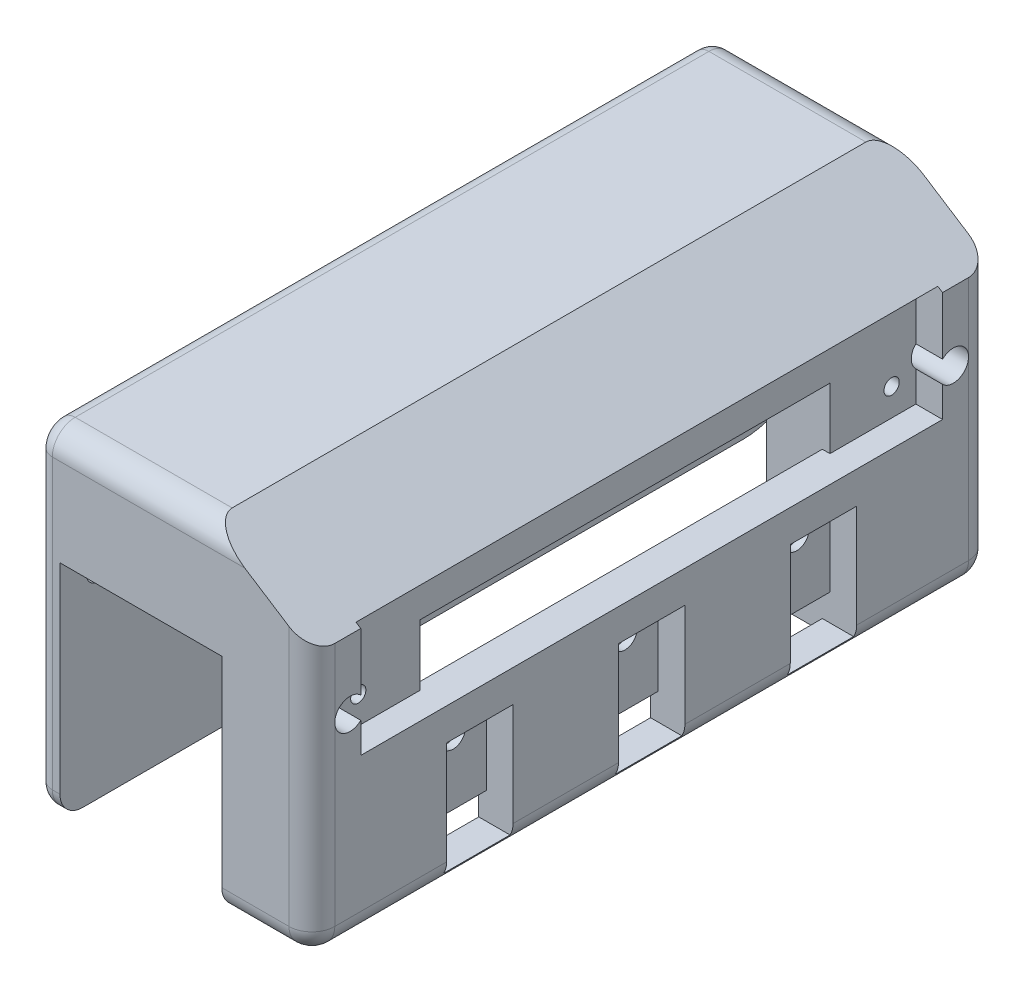
from build123d import *

# Parameters (mm, degrees)
RESSALTO_EXTRUS_O2_DEPTH      = 30
RESSALTO_EXTRUS_O3_START      = 3
RESSALTO_EXTRUS_O3_DEPTH      = 3
RESSALTO_EXTRUS_O4_DEPTH      = 3
RESSALTO_EXTRUS_O4_DEPTH_BACK = 8.8
ESBO_O10_R                    = 1.500000000000004
ESBO_O10_R_2                  = 1.5000000000000007
ESBO_O10_R_3                  = 1.5000000000000009
CORTE_EXTRUS_O3_DEPTH         = 9.999999999999998
CORTE_EXTRUS_O4_DEPTH         = 9.999999999999998
FILETE2_R                     = 2
ESBO_O13_R                    = 1.5000000000000007
ESBO_O13_R_2                  = 1.4999999999999998
CORTE_EXTRUS_O5_DEPTH         = 16
CORTE_EXTRUS_O6_DEPTH         = 3.5
ESBO_O16_R                    = 0.9999999999999981
ESBO_O16_R_2                  = 1.0000000000000013
CORTE_EXTRUS_O7_DEPTH         = 8.3
CORTE_EXTRUS_O8_DEPTH         = 3.5
ESBO_O20_R                    = 1.5999999999999979
ESBO_O20_R_2                  = 1.6000000000000019
CORTE_EXTRUS_O9_DEPTH         = 8.3
ESBO_O21_W                    = 8.700000000000001
ESBO_O21_H                    = 3.4999999999999982
CORTE_EXTRUS_O10_DEPTH        = 8.3
CORTE_EXTRUS_O11_DEPTH        = 8.3
CORTE_EXTRUS_O12_REACH        = 83.702
CORTE_EXTRUS_O15_DEPTH        = 98.90246669046874
ESBO_O27_R                    = 1.9999999999999996
CORTE_EXTRUS_O16_DEPTH        = 15.5
ESBO_O29_R                    = 2.000000000000003
CORTE_EXTRUS_O17_DEPTH        = 15.5
FILETE5_R                     = 3
CORTE_EXTRUS_O18_DEPTH        = 70.5176170215178
CORTE_EXTRUS_O18_DEPTH_BACK   = 24.2


with BuildPart() as part:
    # Esboço2 → Ressalto-extrusão2 (new body)
    with BuildSketch(Plane(origin=(0, 0, 0), x_dir=(0, 0, -1), z_dir=(1, 0, 0))):
        with BuildLine():
            Line((2.901599919865161, -0.06246593766177921), (-35.09840008013481, -0.06246593766176534))
            Line((-35.09840008013481, -0.06246593766176534), (-39.886084902926825, -0.06246593766177921))
            ThreePointArc((-39.886084902926825, -0.06246593766177921), (-45.20218023363878, 1.4676385237390175), (-48.891439327799866, 5.589707975381692))
            ThreePointArc((-48.891439327799866, 5.589707975381692), (-52.09653694789475, 9.772081498832542), (-56.69840008013493, 12.338743680758546))
            ThreePointArc((-56.69840008013493, 12.338743680758546), (-59.37322401506481, 11.895603400997262), (-60.5984000801349, 9.476926076507686))
            Line((-60.5984000801349, 9.476926076507686), (-60.598400080134894, 20.976926076507663))
            ThreePointArc((-60.598400080134894, 20.976926076507663), (-59.71972042369454, 23.098246420067323), (-57.59840008013488, 23.976926076507684))
            Line((-57.59840008013488, 23.976926076507684), (25.401599919865156, 23.976926076507684))
            ThreePointArc((25.401599919865156, 23.976926076507684), (27.522920263424812, 23.098246420067333), (28.401599919865177, 20.976926076507684))
            Line((28.401599919865177, 20.976926076507684), (28.40159991986526, 9.476926076507686))
            ThreePointArc((28.40159991986526, 9.476926076507686), (27.176423854795164, 11.895603400997262), (24.50159991986529, 12.338743680758546))
            ThreePointArc((24.50159991986529, 12.338743680758546), (19.8997367876251, 9.772081498832549), (16.69463916753021, 5.589707975381692))
            ThreePointArc((16.69463916753021, 5.589707975381692), (13.005380073369123, 1.467638523739021), (7.689284742657176, -0.06246593766177921))
            Line((7.689284742657176, -0.06246593766177921), (2.901599919865161, -0.06246593766177921))
        make_face()
    extrude(amount=RESSALTO_EXTRUS_O2_DEPTH)

    # Esboço3 → Ressalto-extrusão3 (add)
    with BuildSketch(Plane.ZY.offset(RESSALTO_EXTRUS_O3_START)):
        with BuildLine():
            Line((60.598400080134894, 15.226926076507677), (60.59840008013489, 20.976926076507663))
            ThreePointArc((60.59840008013489, 20.976926076507663), (59.71972042369454, 23.098246420067326), (57.59840008013487, 23.976926076507684))
            Line((57.59840008013487, 23.976926076507684), (16.09840008013486, 23.976926076507684))
            Line((16.09840008013486, 23.976926076507684), (-25.4015999198652, 23.976926076507684))
            ThreePointArc((-25.4015999198652, 23.976926076507684), (-27.52292026342486, 23.098246420067326), (-28.40159991986522, 20.976926076507663))
            Line((-28.40159991986522, 20.976926076507663), (-28.40159991986522, 15.226926076507686))
            Line((-28.40159991986522, 15.226926076507686), (-28.40159991986525, -16.773073923492294))
            ThreePointArc((-28.40159991986525, -16.773073923492294), (-27.522920263424897, -18.894394267051958), (-25.401599919865234, -19.77307392349232))
            Line((-25.401599919865234, -19.77307392349232), (57.59840008013488, -19.773073923492326))
            ThreePointArc((57.59840008013488, -19.773073923492326), (59.71972042369455, -18.89439426705197), (60.5984000801349, -16.7730739234923))
            Line((60.5984000801349, -16.7730739234923), (60.598400080134894, 15.226926076507677))
        make_face()
    extrude(amount=-RESSALTO_EXTRUS_O3_DEPTH)

    # Esboço4 → Ressalto-extrusão4 (add, two sides: drawn at the far end of the back side and taken through both)
    with BuildSketch(Plane(origin=(30, 0, 0), x_dir=(0, 0, -1), z_dir=(1, 0, 0)).offset(-RESSALTO_EXTRUS_O4_DEPTH_BACK)):
        with BuildLine():
            Line((-16.09840008013486, 23.976926076507684), (25.4015999198652, 23.976926076507684))
            ThreePointArc((25.4015999198652, 23.976926076507684), (27.52292026342486, 23.098246420067326), (28.40159991986522, 20.976926076507663))
            Line((28.40159991986522, 20.976926076507663), (28.40159991986522, 15.226926076507686))
            Line((28.40159991986522, 15.226926076507686), (28.40159991986523, -16.773073923492294))
            ThreePointArc((28.40159991986523, -16.773073923492294), (27.522920263424872, -18.89439426705196), (25.401599919865205, -19.77307392349232))
            Line((25.401599919865205, -19.77307392349232), (-57.598400080134866, -19.773073923492326))
            ThreePointArc((-57.598400080134866, -19.773073923492326), (-59.71972042369453, -18.89439426705197), (-60.59840008013489, -16.773073923492305))
            Line((-60.59840008013489, -16.773073923492305), (-60.598400080134894, 15.226926076507677))
            Line((-60.598400080134894, 15.226926076507677), (-60.598400080134894, 20.976926076507663))
            ThreePointArc((-60.598400080134894, 20.976926076507663), (-59.71972042369454, 23.098246420067326), (-57.59840008013487, 23.976926076507684))
            Line((-57.59840008013487, 23.976926076507684), (-16.09840008013486, 23.976926076507684))
        make_face()
    extrude(amount=RESSALTO_EXTRUS_O4_DEPTH + RESSALTO_EXTRUS_O4_DEPTH_BACK)

    # Esboço10 → Corte-extrusão3 (cut)
    with BuildSketch(Plane(origin=(0, 0, 0), x_dir=(0, 0, -1), z_dir=(1, 0, 0))):
        with Locations((-55.59840008013491, 6.338743680758544)):
            Circle(ESBO_O10_R)
        with Locations((23.401599919865223, 6.338743680758553)):
            Circle(ESBO_O10_R_2)
        with Locations((-16.098400080134773, -8.56246593766178)):
            Circle(ESBO_O10_R_3)
    extrude(amount=-CORTE_EXTRUS_O3_DEPTH, mode=Mode.SUBTRACT)

    # Esboço12 → Corte-extrusão4 (cut)
    with BuildSketch(Plane(origin=(0, 0, 0), x_dir=(0, 0, -1), z_dir=(1, 0, 0))):
        with BuildLine():
            Line((-31.59840008013476, -2.862465937661779), (-25.598400080134788, -2.862465937661779))
            ThreePointArc((-25.598400080134788, -2.862465937661779), (-24.184186517761677, -3.4482523752886847), (-23.598400080134773, -4.862465937661794))
            Line((-23.598400080134773, -4.862465937661794), (-23.598400080134773, -14.773073923492307))
            ThreePointArc((-23.598400080134773, -14.773073923492307), (-24.18418651776168, -16.187287485865415), (-25.598400080134788, -16.77307392349232))
            Line((-25.598400080134788, -16.77307392349232), (-31.59840008013476, -16.77307392349232))
            ThreePointArc((-31.59840008013476, -16.77307392349232), (-33.012613642507866, -16.187287485865415), (-33.59840008013477, -14.773073923492307))
            Line((-33.59840008013477, -14.773073923492307), (-33.59840008013477, -4.862465937661794))
            ThreePointArc((-33.59840008013477, -4.862465937661794), (-33.012613642507866, -3.4482523752886842), (-31.59840008013476, -2.862465937661779))
        make_face()
        with BuildLine():
            Line((-6.5984000801348905, -2.862465937661779), (-0.5984000801349185, -2.862465937661779))
            ThreePointArc((-0.5984000801349185, -2.862465937661779), (0.815813482238191, -3.4482523752886842), (1.4015999198650957, -4.862465937661794))
            Line((1.4015999198650957, -4.862465937661794), (1.401599919865097, -14.773073923492307))
            ThreePointArc((1.401599919865097, -14.773073923492307), (0.8158134822381905, -16.187287485865415), (-0.5984000801349172, -16.77307392349232))
            Line((-0.5984000801349172, -16.77307392349232), (-6.598400080134889, -16.77307392349232))
            ThreePointArc((-6.598400080134889, -16.77307392349232), (-8.012613642507999, -16.187287485865415), (-8.598400080134903, -14.773073923492307))
            Line((-8.598400080134903, -14.773073923492307), (-8.598400080134905, -4.862465937661794))
            ThreePointArc((-8.598400080134905, -4.862465937661794), (-8.012613642507999, -3.448252375288684), (-6.5984000801348905, -2.862465937661779))
        make_face()
    extrude(amount=-CORTE_EXTRUS_O4_DEPTH, mode=Mode.SUBTRACT)

    # Filete2
    filete2_edges = [part.edges().sort_by_distance(p)[0] for p in [
        (-3, 2.101926076507681, 60.598400080134894),
        (-3, 23.09824642006733, 59.71972042369454),
        (-3, 23.976926076507684, 16.098400080134837),
        (-3, 23.098246420067326, -27.52292026342486),
        (-3, 2.1019260765076844, -28.401599919865234),
        (-3, -18.894394267051958, -27.522920263424897),
        (-3, -19.773073923492323, 16.098400080134823),
        (-3, -18.89439426705197, 59.71972042369455),
    ]]
    fillet(filete2_edges, radius=FILETE2_R)

    # Esboço13 → Corte-extrusão5 (cut)
    with BuildSketch(Plane.ZY.offset(3)):
        with Locations((27.44840008013482, 3.97692607650768)):
            Circle(ESBO_O13_R)
        with Locations((4.7484000801348225, 3.97692607650768)):
            Circle(ESBO_O13_R_2)
    extrude(amount=-CORTE_EXTRUS_O5_DEPTH, mode=Mode.SUBTRACT)

    # Esboço14 → Corte-extrusão6 (cut)
    with BuildSketch(Plane(origin=(33, 0, 0), x_dir=(0, 0, -1), z_dir=(1, 0, 0))):
        Polygon((-54.198400080134846, 15.726926076507674), (22.00159991986516, 15.726926076507674), (22.001599919865164, 0.9269260765076732), (-54.198400080134846, 0.9269260765076732), align=None)
    extrude(amount=-CORTE_EXTRUS_O6_DEPTH, mode=Mode.SUBTRACT)

    # Esboço16 → Corte-extrusão7 (cut)
    with BuildSketch(Plane(origin=(29.500000000000004, 0, 0), x_dir=(0, 0, -1), z_dir=(1, 0, 0))):
        with Locations((-51.02340008013484, 4.516926076507664)):
            Circle(ESBO_O16_R)
        with Locations((18.826599919865156, 4.516926076507673)):
            Circle(ESBO_O16_R_2)
    extrude(amount=-CORTE_EXTRUS_O7_DEPTH, mode=Mode.SUBTRACT)

    # Esboço17 → Corte-extrusão8 (cut)
    with BuildSketch(Plane(origin=(33, 0, 0), x_dir=(0, 0, -1), z_dir=(1, 0, 0))):
        Polygon((10.751599919865162, -3.273073923492324), (2.051599919865163, -3.273073923492325), (2.0515999198651653, -18.273073923492326), (10.751599919865164, -18.273073923492323), align=None)
        Polygon((-11.748400080134838, -3.2730739234923263), (-20.448400080134835, -3.273073923492327), (-20.448400080134835, -18.273073923492326), (-11.748400080134836, -18.27307392349233), align=None)
        Polygon((-34.24840008013484, -3.273073923492329), (-42.94840008013484, -3.27307392349233), (-42.94840008013483, -18.273073923492333), (-34.248400080134836, -18.27307392349233), align=None)
    extrude(amount=-CORTE_EXTRUS_O8_DEPTH, mode=Mode.SUBTRACT)

    # Esboço20 → Corte-extrusão9 (cut)
    with BuildSketch(Plane(origin=(29.500000000000004, 0, 0), x_dir=(0, 0, -1), z_dir=(1, 0, 0))):
        with Locations((-38.59840008013484, -6.313073923492322)):
            Circle(ESBO_O20_R)
        with Locations((-16.098400080134837, -6.313073923492322)):
            Circle(ESBO_O20_R_2)
        with Locations((6.401599919865163, -6.313073923492322)):
            Circle(ESBO_O20_R_2)
    extrude(amount=-CORTE_EXTRUS_O9_DEPTH, mode=Mode.SUBTRACT)

    # Esboço21 → Corte-extrusão10 (cut)
    with BuildSketch(Plane(origin=(29.500000000000004, 0, 0), x_dir=(0, 0, -1), z_dir=(1, 0, 0))):
        Polygon((-34.248400080134836, -18.273073923492333), (-42.94840008013484, -18.273073923492333), (-42.94840008013484, -14.773073923492335), (-34.248400080134836, -14.773073923492332), align=None)
        Polygon((-11.748400080134836, -18.27307392349233), (-20.448400080134835, -18.27307392349233), (-20.448400080134835, -14.77307392349233), (-11.748400080134836, -14.773073923492328), align=None)
        with Locations((6.401599919865164, -16.523073923492326)):
            Rectangle(ESBO_O21_W, ESBO_O21_H)
    extrude(amount=-CORTE_EXTRUS_O10_DEPTH, mode=Mode.SUBTRACT)

    # Esboço22 → Corte-extrusão11 (cut)
    with BuildSketch(Plane(origin=(29.500000000000004, 0, 0), x_dir=(0, 0, -1), z_dir=(1, 0, 0))):
        Polygon((-33.238400080134845, 0.9269260765076732), (1.041599919865164, 0.9269260765076732), (1.0415999198651673, 8.926926076507673), (-33.238400080134845, 8.926926076507673), align=None)
    extrude(amount=-CORTE_EXTRUS_O11_DEPTH, mode=Mode.SUBTRACT)

    # Corte-extrusão12: up to this face of the body (flat: up to its plane)
    corte_extrus_o12_end = Plane(part.part.faces().sort_by_distance((25.35, 8.926926077, 16.09840008))[0])
    # Esboço23 → Corte-extrusão12 (cut, up to the picked face)
    with BuildSketch(Plane.XZ.offset(19.773073923492323), mode=Mode.PRIVATE) as corte_extrus_o12_sk1:
        Polygon((28.5, 42.94840008013484), (21.199999999999996, 42.94840008013484), (21.199999999999996, -10.751599919865157), (28.500000000000007, -10.751599919865157), align=None)
    corte_extrus_o12_tool1 = split(extrude(corte_extrus_o12_sk1.sketch, amount=-CORTE_EXTRUS_O12_REACH, mode=Mode.PRIVATE), bisect_by=corte_extrus_o12_end, keep=Keep.BOTH, mode=Mode.PRIVATE)
    add(corte_extrus_o12_tool1.solids().sort_by(Axis((24.85, -19.773074, 16.0984), (0, 1, 8e-17)))[0], mode=Mode.SUBTRACT)

    # Esboço26 → Corte-extrusão15 (cut, through all)
    with BuildSketch(Plane.XY.offset(60.59840008013491)):
        Polygon((33, 15.326926076507647), (19.555618972033173, 23.976926076507645), (33, 23.976926076507645), align=None)
    extrude(amount=-CORTE_EXTRUS_O15_DEPTH, mode=Mode.SUBTRACT)

    # Esboço27 → Corte-extrusão16 (cut)
    with BuildSketch(Plane.ZY.offset(-21.199999999999996)):
        with Locations((-23.401599919865223, 6.338743680758553)):
            Circle(ESBO_O27_R)
    extrude(amount=-CORTE_EXTRUS_O16_DEPTH, mode=Mode.SUBTRACT)

    # Esboço29 → Corte-extrusão17 (cut)
    with BuildSketch(Plane.ZY.offset(-21.199999999999996)):
        with Locations((55.59840008013491, 6.338743680758544)):
            Circle(ESBO_O29_R)
    extrude(amount=-CORTE_EXTRUS_O17_DEPTH, mode=Mode.SUBTRACT)

    # Filete5
    # the kernel refuses this fillet: 3 mm, written as the material it takes off along each edge
    with BuildSketch(Plane(origin=(33, -16.773073923492305, 60.59840008013489), x_dir=(-1, 0, 1.658e-14), z_dir=(0, 1, 1.9e-16))) as filete5_piece_1:
        with BuildLine():
            CenterArc((FILETE5_R, -FILETE5_R), FILETE5_R, 89.99999999999906, 90.00000000000108)
            Line((-4.974e-14, -FILETE5_R), (0, 0))
            Line((0, 0), (FILETE5_R, 0))
        make_face()
    extrude(amount=39.6, mode=Mode.SUBTRACT)
    with BuildSketch(Plane(origin=(33, -16.773073923492326, 57.59840008013489), x_dir=(0, -1, -7.11e-15), z_dir=(0, 7.11e-15, -1))) as filete5_piece_2:
        with BuildLine():
            CenterArc((3 - FILETE5_R, FILETE5_R), FILETE5_R, 270, 90)
            Line((3, FILETE5_R), (3, 0))
            Line((3, 0), (3 - FILETE5_R, 0))
        make_face()
    revolve(axis=Axis((33, -16.773073923492326, 57.59840008013489), (-1, 0, 0)), revolution_arc=90.00000000000081, mode=Mode.SUBTRACT)
    with BuildSketch(Plane(origin=(33, -19.77307392349232, -25.401599919865205), x_dir=(0, 1, 9e-17), z_dir=(0, -9e-17, 1))) as filete5_piece_3:
        with BuildLine():
            CenterArc((FILETE5_R, FILETE5_R), FILETE5_R, 180, 90)
            Line((0, FILETE5_R), (0, 0))
            Line((0, 0), (FILETE5_R, 0))
        make_face()
    extrude(amount=83.00000000000007, mode=Mode.SUBTRACT)
    with BuildSketch(Plane(origin=(33, -16.77307392349232, -25.401599919865227), x_dir=(0, 8.29e-15, -1), z_dir=(0, 1, 8.29e-15))) as filete5_piece_4:
        with BuildLine():
            CenterArc((3 - FILETE5_R, FILETE5_R), FILETE5_R, 270, 90)
            Line((3.0000000000000036, FILETE5_R), (3, 0))
            Line((3, 0), (3 - FILETE5_R, 0))
        make_face()
    revolve(axis=Axis((33, -16.77307392349232, -25.401599919865227), (-1, 0, 0)), revolution_arc=90.0000000000009, mode=Mode.SUBTRACT)
    with BuildSketch(Plane(origin=(33, 22.826926076507682, -28.401599919865216), x_dir=(0, -1.9e-16, 1), z_dir=(0, -1, -1.9e-16))) as filete5_piece_5:
        with BuildLine():
            CenterArc((FILETE5_R, FILETE5_R), FILETE5_R, 180, 90)
            Line((0, FILETE5_R), (0, 0))
            Line((0, 0), (FILETE5_R, 0))
        make_face()
    extrude(amount=39.59999999999998, mode=Mode.SUBTRACT)

    # Esboço30 → Corte-extrusão18 (cut, two sides: drawn at the far end of the back side and taken through both)
    with BuildSketch(Plane(origin=(21.199999999999996, 0, 0), x_dir=(0, 0, -1), z_dir=(1, 0, 0)).offset(-CORTE_EXTRUS_O18_DEPTH_BACK)):
        Polygon((10.751599919865157, 8.926926076507677), (-42.94840008013484, 8.92692607650767), (-42.94840008013484, 0.9269260765076663), (10.751599919865159, 0.9269260765076732), align=None)
    extrude(amount=CORTE_EXTRUS_O18_DEPTH + CORTE_EXTRUS_O18_DEPTH_BACK, mode=Mode.SUBTRACT)


solid = part.part
